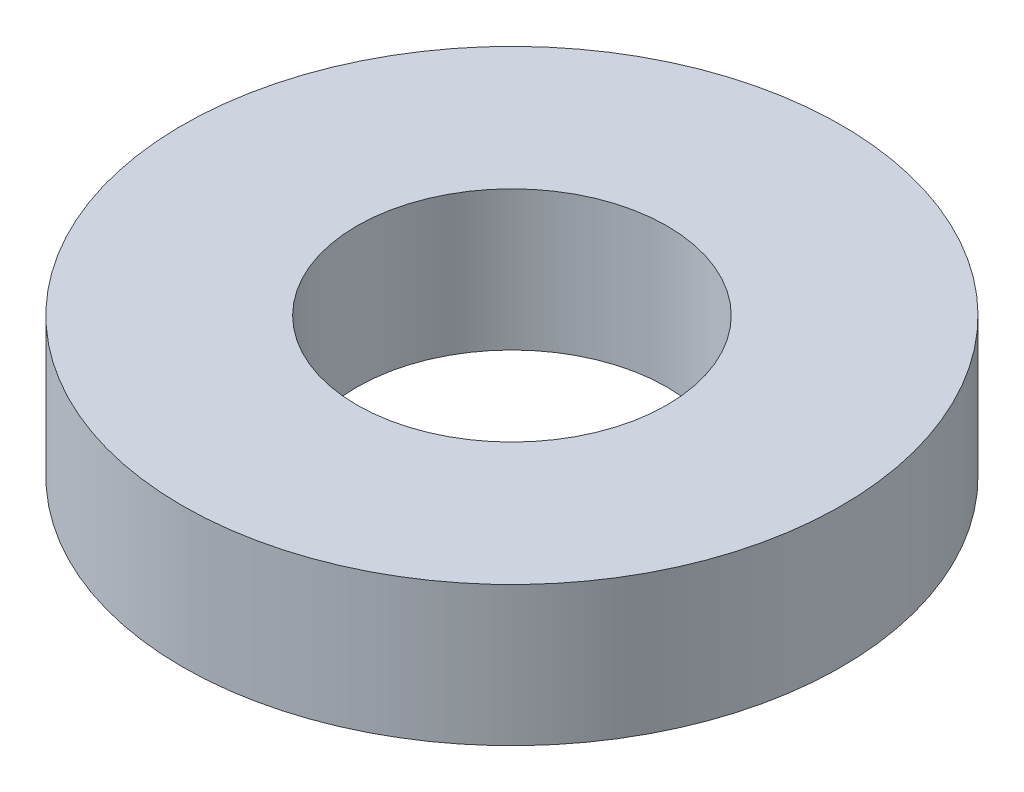
from build123d import *

# Parameters (mm, degrees)
SKETCH1_R           = 42.5
BOSS_EXTRUDE1_DEPTH = 18
SKETCH2_R           = 20
CUT_EXTRUDE1_DEPTH  = 63.741533293


with BuildPart() as part:
    # Sketch1 → Boss-Extrude1 (new body)
    with BuildSketch(Plane(origin=(0, 0, 0), x_dir=(1, 0, 0), z_dir=(0, 1, 0))):
        Circle(SKETCH1_R)
    extrude(amount=BOSS_EXTRUDE1_DEPTH)

    # Sketch2 → Cut-Extrude1 (cut, through all)
    with BuildSketch(Plane(origin=(0, 0, 0), x_dir=(1, 0, 0), z_dir=(0, 1, 0))):
        Circle(SKETCH2_R)
    extrude(amount=CUT_EXTRUDE1_DEPTH, mode=Mode.SUBTRACT)


solid = part.part
